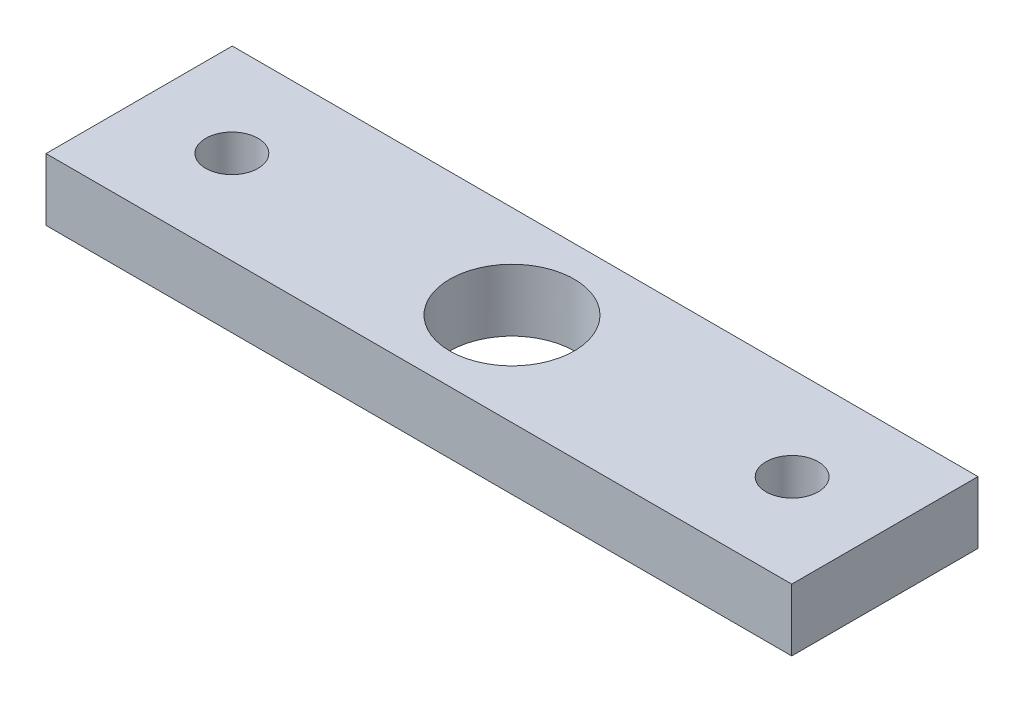
from build123d import *

# Parameters (mm, degrees)
SKETCH1_W           = 76.073
SKETCH1_H           = 19
BOSS_EXTRUDE1_DEPTH = 6.35
CUT_EXTRUDE2_REACH  = 41.716
SKETCH2_R           = 6.35
CUT_EXTRUDE3_REACH  = 41.716
SKETCH4_R           = 2.665


with BuildPart() as part:
    # Sketch1 → Boss-Extrude1 (new body)
    with BuildSketch(Plane(origin=(0, 0, 0), x_dir=(1, 0, 0), z_dir=(0, 1, 0))):
        Rectangle(SKETCH1_W, SKETCH1_H)
    extrude(amount=BOSS_EXTRUDE1_DEPTH)

    # Sketch2 → Cut-Extrude2 (cut, up to next)
    with BuildSketch(Plane(origin=(0, 6.35, 0), x_dir=(1, 0, 0), z_dir=(0, 1, 0)), mode=Mode.PRIVATE) as cut_extrude2_sk1:
        Circle(SKETCH2_R)
    cut_extrude2_tool1 = extrude(cut_extrude2_sk1.sketch, amount=-CUT_EXTRUDE2_REACH, mode=Mode.PRIVATE) & part.part
    add(cut_extrude2_tool1.solids().sort_by_distance((0, 6.35, 0))[0], mode=Mode.SUBTRACT)

    # Sketch4 → Cut-Extrude3 (cut, up to next)
    with BuildSketch(Plane(origin=(0, 6.35, 0), x_dir=(1, 0, 0), z_dir=(0, 1, 0)), mode=Mode.PRIVATE) as cut_extrude3_sk1:
        with Locations((28.575, 0)):
            Circle(SKETCH4_R)
    cut_extrude3_tool1 = extrude(cut_extrude3_sk1.sketch, amount=-CUT_EXTRUDE3_REACH, mode=Mode.PRIVATE) & part.part
    # Sketch4 → Cut-Extrude3 (cut, up to next)
    with BuildSketch(Plane(origin=(0, 6.35, 0), x_dir=(1, 0, 0), z_dir=(0, 1, 0)), mode=Mode.PRIVATE) as cut_extrude3_sk2:
        with Locations((-28.575, 0)):
            Circle(SKETCH4_R)
    cut_extrude3_tool2 = extrude(cut_extrude3_sk2.sketch, amount=-CUT_EXTRUDE3_REACH, mode=Mode.PRIVATE) & part.part
    add(cut_extrude3_tool1.solids().sort_by_distance((28.575, 6.35, 0))[0], mode=Mode.SUBTRACT)
    add(cut_extrude3_tool2.solids().sort_by_distance((-28.575, 6.35, 0))[0], mode=Mode.SUBTRACT)


solid = part.part
